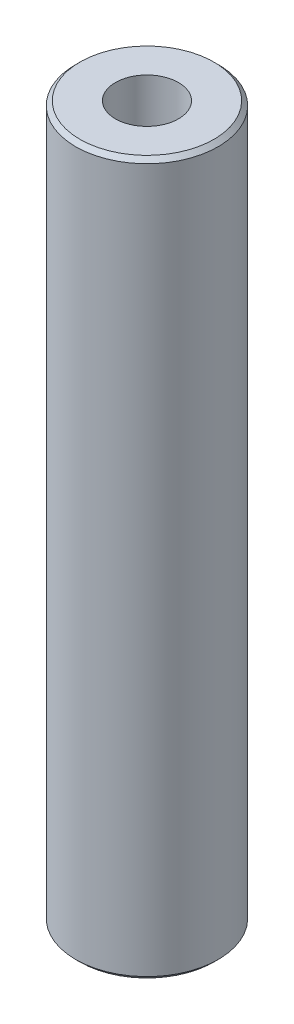
from build123d import *

# Parameters (mm, degrees)
SKETCH1_R           = 60
BOSS_EXTRUDE1_DEPTH = 600
SKETCH2_R           = 26.554968728
CUT_EXTRUDE1_DEPTH  = 606.970296302
CHAMFER1_SIZE       = 3.586613944


with BuildPart() as part:
    # Sketch1 → Boss-Extrude1 (new body)
    with BuildSketch(Plane(origin=(0, 0, 0), x_dir=(1, 0, 0), z_dir=(0, 1, 0))):
        Circle(SKETCH1_R)
    extrude(amount=BOSS_EXTRUDE1_DEPTH)

    # Sketch2 → Cut-Extrude1 (cut, through all)
    with BuildSketch(Plane(origin=(0, 0, 0), x_dir=(1, 0, 0), z_dir=(0, 1, 0))):
        Circle(SKETCH2_R)
    extrude(amount=CUT_EXTRUDE1_DEPTH, mode=Mode.SUBTRACT)

    # Chamfer1
    chamfer1_edges = [part.edges().sort_by_distance(p)[0] for p in [
        (-60, 600, 0),
        (-60, 0, 0),
    ]]
    chamfer(chamfer1_edges, length=CHAMFER1_SIZE)


solid = part.part
